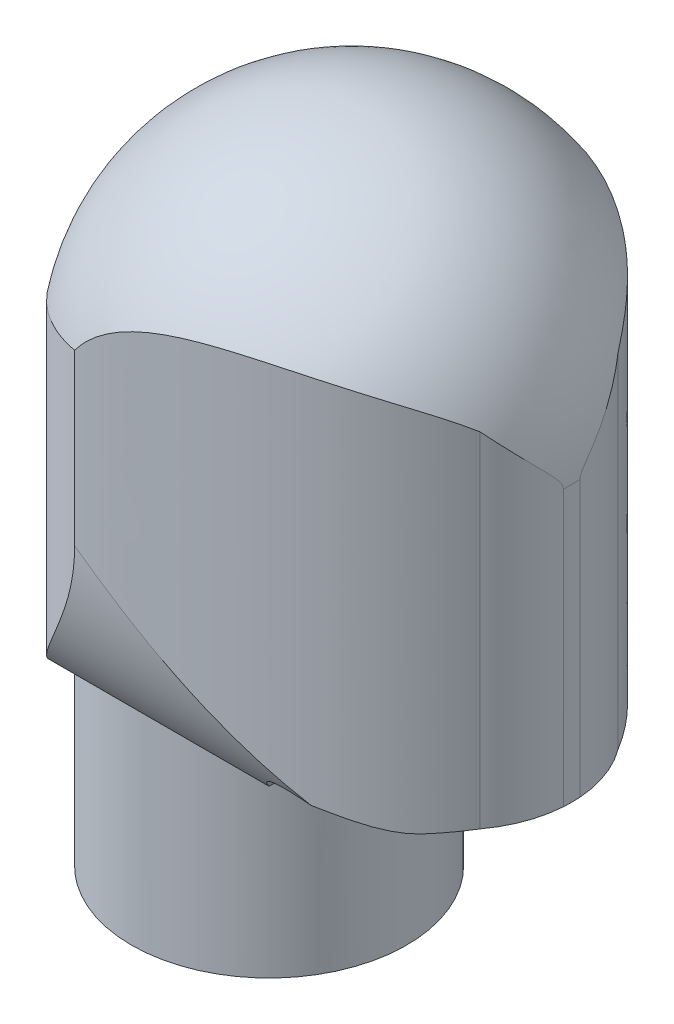
from build123d import *

# Parameters (mm, degrees)
SKETCH4_R               = 50
BOSS_EXTRUDE2_DEPTH     = 75
SKETCH5_R               = 80
BOSS_EXTRUDE3_DEPTH     = 100
CUT_EXTRUDE1_DEPTH      = 177.00000000000014
CUT_EXTRUDE2_START      = -30.69539479
CUT_EXTRUDE2_DEPTH      = 109.286881196
CUT_EXTRUDE3_DEPTH      = 287.56061075594243
CUT_EXTRUDE3_DEPTH_BACK = 287.56061075594243


# Read off the part's stored shape, not the designer's step: Cut-Extrude2
with BuildPart() as part:
    # Sketch4 → Boss-Extrude2 (new body)
    with BuildSketch(Plane(origin=(0, 0, 0), x_dir=(1, 0, 0), z_dir=(0, 1, 0))):
        with Locations(Location((0, 0, 0), (0, 0, 270))):
            Circle(SKETCH4_R)
    extrude(amount=BOSS_EXTRUDE2_DEPTH)

    # Sketch5 → Boss-Extrude3 (add)
    with BuildSketch(Plane(origin=(0, 75, 0), x_dir=(1, 0, 0), z_dir=(0, 1, 0))):
        with Locations(Location((30, 0, 0), (0, 0, 180))):
            Circle(SKETCH5_R)
    extrude(amount=BOSS_EXTRUDE3_DEPTH)

    # Sketch11 → Revolve1 (revolve)
    with BuildSketch(Plane.XY):
        with BuildLine():
            Line((29.999999999999996, 255), (30, 175))
            Line((30, 175), (-50, 175))
            ThreePointArc((-50, 175), (-26.568542494923797, 231.5685424949238), (29.999999999999996, 255))
        make_face()
    revolve(axis=Axis((29.999999999999996, 278.42314240777455, 0), (3e-17, -1, 0)))

    # Sketch12 → Cut-Extrude1 (cut)
    with BuildSketch(Plane.XZ.offset(-75)):
        with BuildLine():
            ThreePointArc((101.75235588036907, 25.081268476692404), (107.42493420820286, 14.627460541602623), (109.94359897636991, 3.00349508162513))
            ThreePointArc((109.94359897636991, 3.003495081625128), (28.497987997230986, 79.98589850682143), (-50, 5.9180458847e-07))
            ThreePointArc((-49.99999999999999, 5.9180458924e-07), (-49.839008392265235, 4.009144855915759), (-49.357070395571, 7.992471580596885))
            ThreePointArc((-49.357070395570936, 7.992471580596874), (-33.695523129529406, 46.42570222744743), (-2.487e-14, 70.65397087685398))
            add(Edge.make_bspline(
                [(1.826e-14, 70.65397087685398), (73.86521176603569, 70.61474833349187), (101.75235588036907, 25.081268476692404)],
                knots=[0, 0, 0, 0.8029905848985768, 0.8029905848985768, 0.8029905848985768], degree=2))
        make_face()
        with BuildLine():
            ThreePointArc((109.94359897637614, -3.003495081459447), (107.42493420821802, -14.627460541482936), (101.7523558803691, -25.081268476613513))
            add(Edge.make_bspline(
                [(1.826e-14, -70.65397087685398), (73.86521176603578, -70.61474833341295), (101.75235588036907, -25.08126847661351)],
                knots=[0, 0, 0, 0.8029905848985768, 0.8029905848985768, 0.8029905848985768], degree=2))
            ThreePointArc((-7.11e-15, -70.65397087685399), (-33.695523129529434, -46.42570222744742), (-49.35707039557095, -7.992471580596778))
            ThreePointArc((-49.357070395571014, -7.992471580596786), (-49.839008439717844, -4.009144266016631), (-49.99999999999999, 5.9180458924e-07))
            ThreePointArc((-50, 5.9180458847e-07), (28.497987405613625, -79.98589849571177), (109.94359897637614, -3.003495081459442))
        make_face()
    extrude(amount=-CUT_EXTRUDE1_DEPTH, mode=Mode.SUBTRACT)

    # Cut-Extrude2 outline → Cut-Extrude2 (cut)
    with BuildSketch(Plane(origin=(0, 0, 0), x_dir=(0, 0, -1), z_dir=(1, 0, 0)).offset(CUT_EXTRUDE2_START)):
        with BuildLine():
            Line((-70.653970877, 75), (-50, 75))
            add(Edge.make_bspline(
                [(-70.653970877, 136.012393614), (-70.61776495173824, 99.47946066216707), (-50, 75)],
                knots=[0.00320423925332247, 0.00320423925332247, 0.00320423925332247, 0.9139424556457227, 0.9139424556457227, 0.9139424556457227], degree=2))
            Line((-70.653970877, 136.012393614), (-70.653970877, 75))
        make_face()
        with BuildLine():
            Line((70.653970877, 75), (70.653970877, 136.012393614))
            add(Edge.make_bspline(
                [(70.653970877, 136.012393614), (70.61776495172418, 99.47946066215033), (50, 75)],
                knots=[0.0032042392539459, 0.0032042392539459, 0.0032042392539459, 0.9139424556457227, 0.9139424556457227, 0.9139424556457227], degree=2))
            Line((50, 75), (70.653970877, 75))
        make_face()
    extrude(amount=CUT_EXTRUDE2_DEPTH, mode=Mode.SUBTRACT)

    # Sketch14 → Cut-Extrude3 (cut, two sides: drawn at the far end of the back side and taken through both)
    with BuildSketch(Plane.XY.offset(-CUT_EXTRUDE3_DEPTH_BACK)):
        with BuildLine():
            add(Edge.make_bspline(
                [(50, 75), (57.605742682294384, 93.78917738890438), (81.04287472932185, 74.75023777352393), (93.10569129461423, 75)],
                knots=[0, 0, 0, 0, 1, 1, 1, 1], degree=3))
            Line((93.10569129461423, 75), (50, 75))
        make_face()
    extrude(amount=CUT_EXTRUDE3_DEPTH + CUT_EXTRUDE3_DEPTH_BACK, mode=Mode.SUBTRACT)


solid = part.part
